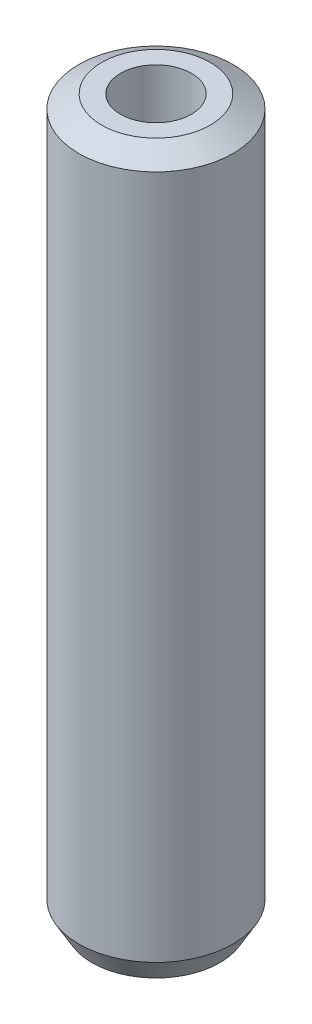
from build123d import *
from OCP.BRepFilletAPI import BRepFilletAPI_MakeChamfer

# Parameters (mm, degrees)
SKETCH1_R           = 7.5
BOSS_EXTRUDE1_DEPTH = 70.050940987
SKETCH2_R           = 3.451885998
CUT_EXTRUDE1_DEPTH  = 71.84937779
CHAMFER1_SIZE       = 1.28017172
CHAMFER1_SIZE2      = 2.217322462


with BuildPart() as part:
    # Sketch1 → Boss-Extrude1 (new body)
    with BuildSketch(Plane(origin=(0, 0, 0), x_dir=(1, 0, 0), z_dir=(0, 1, 0))):
        Circle(SKETCH1_R)
    extrude(amount=BOSS_EXTRUDE1_DEPTH)

    # Sketch2 → Cut-Extrude1 (cut, through all)
    with BuildSketch(Plane(origin=(0, 0, 0), x_dir=(1, 0, 0), z_dir=(0, 1, 0))):
        Circle(SKETCH2_R)
    extrude(amount=CUT_EXTRUDE1_DEPTH, mode=Mode.SUBTRACT)

    # Chamfer1: one chamfer whose edges measure the first distance from different faces: ONE call of the kernel's chamfer builder (chamfer() names one face for all edges)
    chamfer1_edges_1 = [part.edges().sort_by_distance(p)[0] for p in [
        (-7.5, 70.050940987, 0),
    ]]
    chamfer1_side_1 = [part.faces().sort_by_distance(p)[0] for p in [
        (-7.5, 35.025470494, 0),
    ]]
    chamfer1_edges_2 = [part.edges().sort_by_distance(p)[0] for p in [
        (-7.5, 0, 0),
    ]]
    chamfer1_side_2 = [part.faces().sort_by_distance(p)[0] for p in [
        (-7.287867966, 0, 0),
    ]]
    chamfer1 = BRepFilletAPI_MakeChamfer(part.part.solid().wrapped)
    for e in chamfer1_edges_1:
        chamfer1.Add(CHAMFER1_SIZE, CHAMFER1_SIZE2, e.wrapped, chamfer1_side_1[0].wrapped)  # the first distance lies on this face
    for e in chamfer1_edges_2:
        chamfer1.Add(CHAMFER1_SIZE, CHAMFER1_SIZE2, e.wrapped, chamfer1_side_2[0].wrapped)  # the first distance lies on this face
    add(Compound.cast(chamfer1.Shape()), mode=Mode.REPLACE)


solid = part.part
